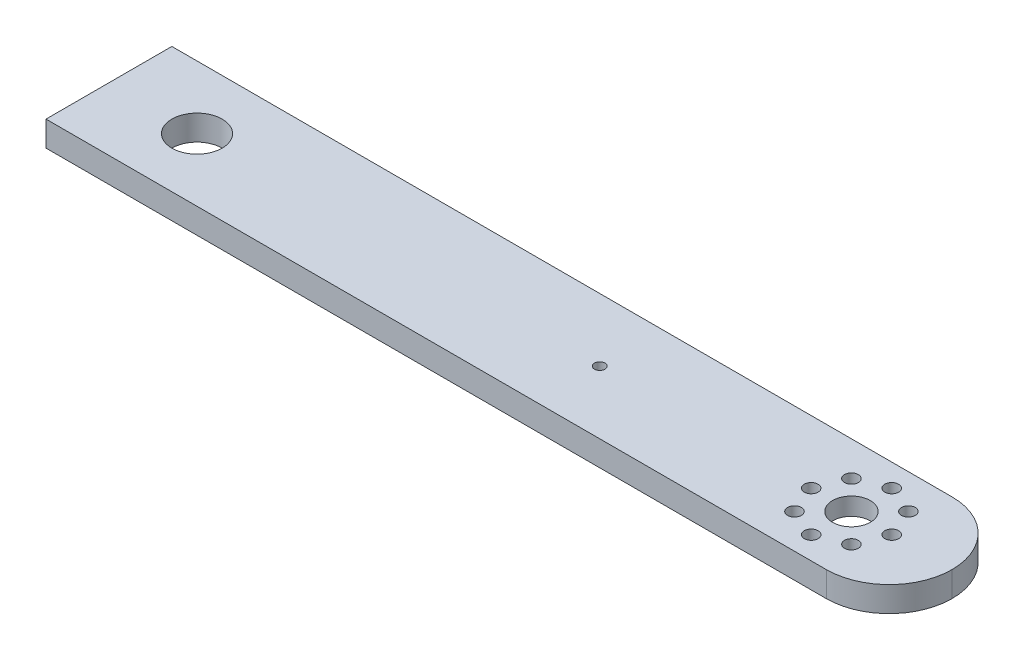
from build123d import *

# Parameters (mm, degrees)
SCHIZZO1_W                   = 335
SCHIZZO1_H                   = 50
SCHIZZO1_R                   = 7.5
SCHIZZO1_R_2                 = 10
ESTRUSIONE_ESTRUSIONE1_DEPTH = 5
SCHIZZO2_R                   = 2.75
TAGLIO_ESTRUSIONE1_DEPTH     = 297.226264872
RIPETIZIONECIRCOLARE1_COUNT  = 8
RACCORDO1_R                  = 25
SCHIZZO3_R                   = 2.1
TAGLIO_ESTRUSIONE2_DEPTH     = 297.226264872
SCHIZZO4_R                   = 21
TAGLIO_ESTRUSIONE3_DEPTH     = 3
SMUSSO1_SIZE                 = 0.5


with BuildPart() as part:
    # Schizzo1 → Estrusione-Estrusione1 (new, symmetric)
    with BuildSketch(Plane(origin=(0, 0, 0), x_dir=(1, 0, 0), z_dir=(0, 1, 0))):
        with Locations((-127.5, 0)):
            Rectangle(SCHIZZO1_W, SCHIZZO1_H)
        with Locations(Location((0, 0, 0), (0, 0, 270))):
            Circle(SCHIZZO1_R, mode=Mode.SUBTRACT)
        with Locations(Location((-260, 0, 0), (0, 0, 270))):
            Circle(SCHIZZO1_R_2, mode=Mode.SUBTRACT)
    extrude(amount=ESTRUSIONE_ESTRUSIONE1_DEPTH, both=True)

    # Schizzo2 → Taglio-Estrusione1 (cut, through all)
    with BuildSketch(Plane(origin=(0, 5, 0), x_dir=(1, 0, 0), z_dir=(0, 1, 0))):
        with Locations(Location((-16, 0, 0), (0, 0, 270))):
            Circle(SCHIZZO2_R)
    taglio_estrusione1 = extrude(amount=-TAGLIO_ESTRUSIONE1_DEPTH, mode=Mode.SUBTRACT)

    # RipetizioneCircolare1: Taglio-Estrusione1 ×8 about axis
    ripetizionecircolare1_axis = Axis((0, 0, 0), (0, 1, 0))
    for i in range(1, RIPETIZIONECIRCOLARE1_COUNT):
        add(taglio_estrusione1.rotate(ripetizionecircolare1_axis, i * 360 / RIPETIZIONECIRCOLARE1_COUNT), mode=Mode.SUBTRACT)

    # Raccordo1
    raccordo1_edges = [part.edges().sort_by_distance(p)[0] for p in [
        (40, 0, 25),
        (40, 0, -25),
    ]]
    fillet(raccordo1_edges, radius=RACCORDO1_R - 0.0001)  # a hair under: the kernel refuses the full size

    # Schizzo3 → Taglio-Estrusione2 (cut, through all)
    with BuildSketch(Plane(origin=(0, 5, 0), x_dir=(1, 0, 0), z_dir=(0, 1, 0))):
        with Locations(Location((-100, 0, 0), (0, 0, 270))):
            Circle(SCHIZZO3_R)
    extrude(amount=-TAGLIO_ESTRUSIONE2_DEPTH, mode=Mode.SUBTRACT)

    # Schizzo4 → Taglio-Estrusione3 (cut)
    with BuildSketch(Plane.XZ.offset(5)):
        with Locations(Location((0, 0, 0), (0, 0, 270))):
            Circle(SCHIZZO4_R)
    extrude(amount=-TAGLIO_ESTRUSIONE3_DEPTH, mode=Mode.SUBTRACT)

    # Smusso1
    smusso1_edges = [part.edges().sort_by_distance(p)[0] for p in [
        (0, -5, 21),
    ]]
    chamfer(smusso1_edges, length=SMUSSO1_SIZE)


solid = part.part
